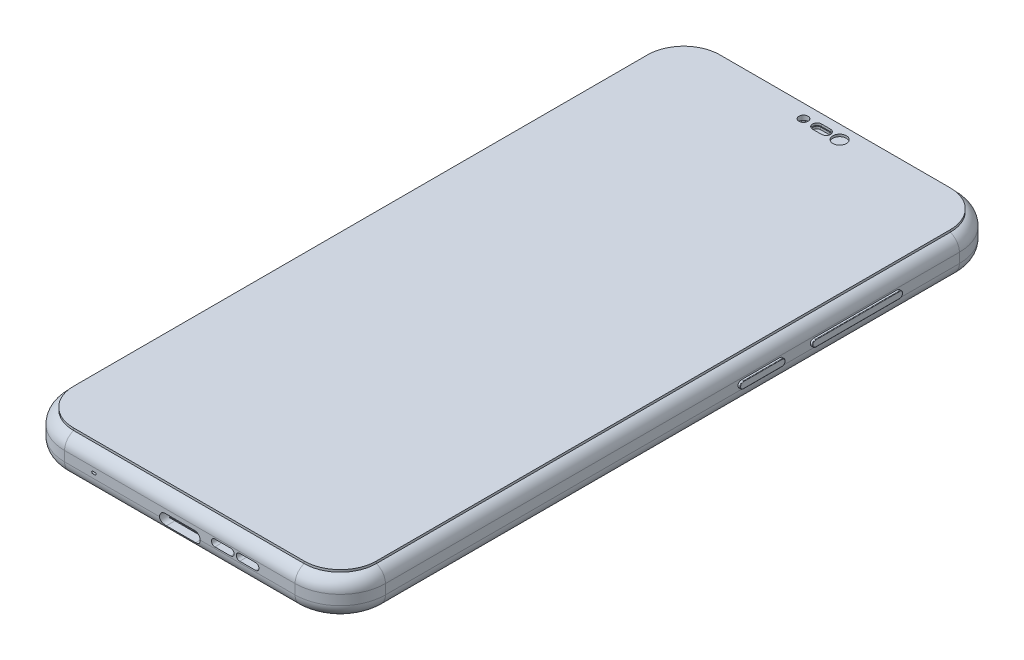
from build123d import *

# Parameters (mm, degrees)
BOSS_EXTRUDE1_DEPTH      = 8
BOSS_EXTRUDE2_DEPTH      = 0.5
FILLET1_R                = 3
BOSS_EXTRUDE3_DEPTH      = 1
FILLET2_R                = 1
CUT_EXTRUDE1_DEPTH       = 1
SKETCH5_R                = 2
CUT_EXTRUDE2_DEPTH       = 0.5
SKETCH6_R                = 0.5
SKETCH6_R_2              = 1
BOSS_EXTRUDE4_DEPTH      = 0.5
FILLET3_R                = 0.5
SKETCH7_R                = 2.5
BOSS_EXTRUDE5_DEPTH      = 0.5
BOSS_EXTRUDE6_DEPTH      = 1
BOSS_EXTRUDE7_DEPTH      = 0.2
SKETCH10_R               = 5
CUT_EXTRUDE3_DEPTH       = 0.2
CHAMFER1_SIZE            = 0.2
SKETCH13_R               = 2
CUT_EXTRUDE4_DEPTH       = 10
SKETCH14_R               = 0.25
CUT_EXTRUDE5_DEPTH       = 1
CUT_EXTRUDE6_DEPTH       = 2
SKETCH17_W               = 6.5
SKETCH17_H               = 0.2
CUT_EXTRUDE7_DEPTH       = 4
SKETCH18_W               = 6.5
SKETCH18_H               = 0.1
CUT_EXTRUDE8_DEPTH       = 1
BOSS_EXTRUDE8_DEPTH      = 0.5
FILLET4_R                = 0.1
SKETCH20_R               = 1.5
CUT_EXTRUDE9_DEPTH       = 0.5
CUT_EXTRUDE10_DEPTH      = 0.5
CUT_EXTRUDE10_DEPTH_BACK = 0.5
SKETCH21_R               = 1
SKETCH22_R               = 0.5
BOSS_EXTRUDE9_DEPTH      = 0.5
FILLET5_R                = 0.5


# Some blends are built 0.0001 mm under size
with BuildPart() as part:
    # Sketch1 → Boss-Extrude1 (new body)
    with BuildSketch(Plane(origin=(0, 0, 0), x_dir=(1, 0, 0), z_dir=(0, 1, 0))):
        with BuildLine():
            Line((-25.5, 73.5), (25.5, 73.5))
            ThreePointArc((25.5, 73.5), (32.571067812, 70.571067812), (35.5, 63.5))
            Line((35.5, 63.5), (35.5, -63.5))
            ThreePointArc((35.5, -63.5), (32.571067812, -70.571067812), (25.5, -73.5))
            Line((25.5, -73.5), (-25.5, -73.5))
            ThreePointArc((-25.5, -73.5), (-32.571067812, -70.571067812), (-35.5, -63.5))
            Line((-35.5, -63.5), (-35.5, 63.5))
            ThreePointArc((-35.5, 63.5), (-32.571067812, 70.571067812), (-25.5, 73.5))
        make_face()
    extrude(amount=BOSS_EXTRUDE1_DEPTH)

    # Sketch2 → Boss-Extrude2 (add)
    with BuildSketch(Plane(origin=(0, 8, 0), x_dir=(1, 0, 0), z_dir=(0, 1, 0))):
        with BuildLine():
            Line((-25.5, -71.5), (25.5, -71.5))
            ThreePointArc((25.5, -71.5), (31.156854249, -69.156854249), (33.5, -63.5))
            Line((33.5, -63.5), (33.5, 63.5))
            ThreePointArc((33.5, 63.5), (31.156854249, 69.156854249), (25.5, 71.5))
            Line((25.5, 71.5), (-25.5, 71.5))
            ThreePointArc((-25.5, 71.5), (-31.156854249, 69.156854249), (-33.5, 63.5))
            Line((-33.5, 63.5), (-33.5, -63.5))
            ThreePointArc((-33.5, -63.5), (-31.156854249, -69.156854249), (-25.5, -71.5))
        make_face()
    extrude(amount=BOSS_EXTRUDE2_DEPTH)

    # Fillet1
    # the kernel refuses this fillet: 3 mm, written as the material it takes off along each edge
    with BuildSketch(Plane(origin=(25.5, 8, 63.5), x_dir=(1, 0, 0), z_dir=(0, 0, -1))) as fillet1_piece_1:
        with BuildLine():
            CenterArc((7, 2.828427125), FILLET1_R, 289.471220634, 70.528779366)
            Line((10, 2.828427125), (10.06, 2.828427125))
            Line((10.06, 2.828427125), (10.06, 0))
            Line((10.06, 0), (10, -0.06))
            ThreePointArc((10, -0.06), (9, -0.06), (8.02, -0.056568542))
            Line((8.02, -0.056568542), (8, 0))
        make_face()
    revolve(axis=Axis((25.5, 8, 63.5), (0, -1, 0)), revolution_arc=90, mode=Mode.SUBTRACT)
    with BuildSketch(Plane(origin=(25.5, 0, 73.5), x_dir=(0, 0, -1), z_dir=(-1, 0, 0))) as fillet1_piece_2:
        with BuildLine():
            CenterArc((FILLET1_R, -FILLET1_R), FILLET1_R, 90, 90)
            Line((0, -FILLET1_R), (-FILLET1_R * 0.02, -FILLET1_R))
            Line((-FILLET1_R * 0.02, -FILLET1_R), (-FILLET1_R * 0.02, FILLET1_R * 0.02))
            Line((-FILLET1_R * 0.02, FILLET1_R * 0.02), (FILLET1_R, FILLET1_R * 0.02))
            Line((FILLET1_R, FILLET1_R * 0.02), (FILLET1_R, 0))
        make_face()
    extrude(amount=51, mode=Mode.SUBTRACT)
    with BuildSketch(Plane(origin=(-25.5, 0, 63.5), x_dir=(0, 0, 1), z_dir=(1, 0, 0))) as fillet1_piece_3:
        with BuildLine():
            CenterArc((10 - FILLET1_R, -FILLET1_R), FILLET1_R, 0, 90)
            Line((10, -FILLET1_R), (10 + FILLET1_R * 0.02, -FILLET1_R))
            Line((10 + FILLET1_R * 0.02, -FILLET1_R), (10 + FILLET1_R * 0.02, FILLET1_R * 0.02))
            Line((10 + FILLET1_R * 0.02, FILLET1_R * 0.02), (10 - FILLET1_R, FILLET1_R * 0.02))
            Line((10 - FILLET1_R, FILLET1_R * 0.02), (10 - FILLET1_R, 0))
        make_face()
    revolve(axis=Axis((-25.5, 0, 63.5), (0, -1, 0)), revolution_arc=90, mode=Mode.SUBTRACT)
    with BuildSketch(Plane(origin=(35.5, 8, -63.5), x_dir=(-1, 0, 0), z_dir=(0, 0, 1))) as fillet1_piece_4:
        with BuildLine():
            CenterArc((3, 2.828427125), FILLET1_R, 180, 70.528779366)
            Line((0, 2.828427125), (-0.06, 2.828427125))
            Line((-0.06, 2.828427125), (-0.06, 0))
            Line((-0.06, 0), (0, -0.06))
            ThreePointArc((0, -0.06), (1, -0.06), (1.98, -0.056568542))
            Line((1.98, -0.056568542), (2, 0))
        make_face()
    extrude(amount=127, mode=Mode.SUBTRACT)
    with BuildSketch(Plane(origin=(25.5, 8, -63.5), x_dir=(0, 0, -1), z_dir=(-1, 0, 0))) as fillet1_piece_5:
        with BuildLine():
            CenterArc((7, 2.828427125), FILLET1_R, 289.471220634, 70.528779366)
            Line((10, 2.828427125), (10.06, 2.828427125))
            Line((10.06, 2.828427125), (10.06, 0))
            Line((10.06, 0), (10, -0.06))
            ThreePointArc((10, -0.06), (9, -0.06), (8.02, -0.056568542))
            Line((8.02, -0.056568542), (8, 0))
        make_face()
    revolve(axis=Axis((25.5, 8, -63.5), (0, -1, 0)), revolution_arc=90, mode=Mode.SUBTRACT)
    with BuildSketch(Plane(origin=(-25.5, 8, -73.5), x_dir=(0, -1, 0), z_dir=(1, 0, 0))) as fillet1_piece_6:
        with BuildLine():
            CenterArc((2.828427125, -3), FILLET1_R, 90, 70.528779366)
            Line((0, -2), (-0.056568542, -1.98))
            ThreePointArc((-0.056568542, -1.98), (-0.06, -1), (-0.06, 0))
            Line((-0.06, 0), (0, 0.06))
            Line((0, 0.06), (2.828427125, 0.06))
            Line((2.828427125, 0.06), (2.828427125, 0))
        make_face()
    extrude(amount=51, mode=Mode.SUBTRACT)
    with BuildSketch(Plane(origin=(-25.5, 8, -63.5), x_dir=(-1, 0, 0), z_dir=(0, 0, 1))) as fillet1_piece_7:
        with BuildLine():
            CenterArc((7, 2.828427125), FILLET1_R, 289.471220634, 70.528779366)
            Line((8, 0), (8.02, -0.056568542))
            ThreePointArc((8.02, -0.056568542), (9, -0.06), (10, -0.06))
            Line((10, -0.06), (10.06, 0))
            Line((10.06, 0), (10.06, 2.828427125))
            Line((10.06, 2.828427125), (10, 2.828427125))
        make_face()
    revolve(axis=Axis((-25.5, 8, -63.5), (0, -1, 0)), revolution_arc=90, mode=Mode.SUBTRACT)
    with BuildSketch(Plane(origin=(-35.5, 8, 63.5), x_dir=(0, -1, 0), z_dir=(0, 0, -1))) as fillet1_piece_8:
        with BuildLine():
            CenterArc((2.828427125, -3), FILLET1_R, 90, 70.528779366)
            Line((0, -2), (-0.056568542, -1.98))
            ThreePointArc((-0.056568542, -1.98), (-0.06, -1), (-0.06, 0))
            Line((-0.06, 0), (0, 0.06))
            Line((0, 0.06), (2.828427125, 0.06))
            Line((2.828427125, 0.06), (2.828427125, 0))
        make_face()
    extrude(amount=127, mode=Mode.SUBTRACT)
    with BuildSketch(Plane(origin=(-25.5, 8, 63.5), x_dir=(0, 0, 1), z_dir=(1, 0, 0))) as fillet1_piece_9:
        with BuildLine():
            CenterArc((7, 2.828427125), FILLET1_R, 289.471220634, 70.528779366)
            Line((10, 2.828427125), (10.06, 2.828427125))
            Line((10.06, 2.828427125), (10.06, 0))
            Line((10.06, 0), (10, -0.06))
            ThreePointArc((10, -0.06), (9, -0.06), (8.02, -0.056568542))
            Line((8.02, -0.056568542), (8, 0))
        make_face()
    revolve(axis=Axis((-25.5, 8, 63.5), (0, -1, 0)), revolution_arc=90, mode=Mode.SUBTRACT)
    with BuildSketch(Plane(origin=(25.5, 8, 73.5), x_dir=(0, 0, -1), z_dir=(-1, 0, 0))) as fillet1_piece_10:
        with BuildLine():
            CenterArc((3, 2.828427125), FILLET1_R, 180, 70.528779366)
            Line((0, 2.828427125), (-0.06, 2.828427125))
            Line((-0.06, 2.828427125), (-0.06, 0))
            Line((-0.06, 0), (0, -0.06))
            ThreePointArc((0, -0.06), (1, -0.06), (1.98, -0.056568542))
            Line((1.98, -0.056568542), (2, 0))
        make_face()
    extrude(amount=51, mode=Mode.SUBTRACT)
    with BuildSketch(Plane(origin=(-35.5, 0, 63.5), x_dir=(0, 1, 0), z_dir=(0, 0, -1))) as fillet1_piece_11:
        with BuildLine():
            CenterArc((FILLET1_R, FILLET1_R), FILLET1_R, 180, 90)
            Line((0, FILLET1_R), (-FILLET1_R * 0.02, FILLET1_R))
            Line((-FILLET1_R * 0.02, FILLET1_R), (-FILLET1_R * 0.02, -FILLET1_R * 0.02))
            Line((-FILLET1_R * 0.02, -FILLET1_R * 0.02), (FILLET1_R, -FILLET1_R * 0.02))
            Line((FILLET1_R, -FILLET1_R * 0.02), (FILLET1_R, 0))
        make_face()
    extrude(amount=127, mode=Mode.SUBTRACT)
    with BuildSketch(Plane(origin=(-25.5, 0, -63.5), x_dir=(-1, 0, 0), z_dir=(0, 0, 1))) as fillet1_piece_12:
        with BuildLine():
            CenterArc((10 - FILLET1_R, -FILLET1_R), FILLET1_R, 0, 90)
            Line((10 - FILLET1_R, 0), (10 - FILLET1_R, FILLET1_R * 0.02))
            Line((10 - FILLET1_R, FILLET1_R * 0.02), (10 + FILLET1_R * 0.02, FILLET1_R * 0.02))
            Line((10 + FILLET1_R * 0.02, FILLET1_R * 0.02), (10 + FILLET1_R * 0.02, -FILLET1_R))
            Line((10 + FILLET1_R * 0.02, -FILLET1_R), (10, -FILLET1_R))
        make_face()
    revolve(axis=Axis((-25.5, 0, -63.5), (0, -1, 0)), revolution_arc=90, mode=Mode.SUBTRACT)
    with BuildSketch(Plane(origin=(-25.5, 0, -73.5), x_dir=(0, 1, 0), z_dir=(1, 0, 0))) as fillet1_piece_13:
        with BuildLine():
            CenterArc((FILLET1_R, FILLET1_R), FILLET1_R, 180, 90)
            Line((0, FILLET1_R), (-FILLET1_R * 0.02, FILLET1_R))
            Line((-FILLET1_R * 0.02, FILLET1_R), (-FILLET1_R * 0.02, -FILLET1_R * 0.02))
            Line((-FILLET1_R * 0.02, -FILLET1_R * 0.02), (FILLET1_R, -FILLET1_R * 0.02))
            Line((FILLET1_R, -FILLET1_R * 0.02), (FILLET1_R, 0))
        make_face()
    extrude(amount=51, mode=Mode.SUBTRACT)
    with BuildSketch(Plane(origin=(25.5, 0, -63.5), x_dir=(0, 0, -1), z_dir=(-1, 0, 0))) as fillet1_piece_14:
        with BuildLine():
            CenterArc((10 - FILLET1_R, -FILLET1_R), FILLET1_R, 0, 90)
            Line((10, -FILLET1_R), (10 + FILLET1_R * 0.02, -FILLET1_R))
            Line((10 + FILLET1_R * 0.02, -FILLET1_R), (10 + FILLET1_R * 0.02, FILLET1_R * 0.02))
            Line((10 + FILLET1_R * 0.02, FILLET1_R * 0.02), (10 - FILLET1_R, FILLET1_R * 0.02))
            Line((10 - FILLET1_R, FILLET1_R * 0.02), (10 - FILLET1_R, 0))
        make_face()
    revolve(axis=Axis((25.5, 0, -63.5), (0, -1, 0)), revolution_arc=90, mode=Mode.SUBTRACT)
    with BuildSketch(Plane(origin=(35.5, 0, -63.5), x_dir=(-1, 0, 0), z_dir=(0, 0, 1))) as fillet1_piece_15:
        with BuildLine():
            CenterArc((FILLET1_R, -FILLET1_R), FILLET1_R, 90, 90)
            Line((0, -FILLET1_R), (-FILLET1_R * 0.02, -FILLET1_R))
            Line((-FILLET1_R * 0.02, -FILLET1_R), (-FILLET1_R * 0.02, FILLET1_R * 0.02))
            Line((-FILLET1_R * 0.02, FILLET1_R * 0.02), (FILLET1_R, FILLET1_R * 0.02))
            Line((FILLET1_R, FILLET1_R * 0.02), (FILLET1_R, 0))
        make_face()
    extrude(amount=127, mode=Mode.SUBTRACT)
    with BuildSketch(Plane(origin=(25.5, 0, 63.5), x_dir=(1, 0, 0), z_dir=(0, 0, -1))) as fillet1_piece_16:
        with BuildLine():
            CenterArc((10 - FILLET1_R, -FILLET1_R), FILLET1_R, 0, 90)
            Line((10, -FILLET1_R), (10 + FILLET1_R * 0.02, -FILLET1_R))
            Line((10 + FILLET1_R * 0.02, -FILLET1_R), (10 + FILLET1_R * 0.02, FILLET1_R * 0.02))
            Line((10 + FILLET1_R * 0.02, FILLET1_R * 0.02), (10 - FILLET1_R, FILLET1_R * 0.02))
            Line((10 - FILLET1_R, FILLET1_R * 0.02), (10 - FILLET1_R, 0))
        make_face()
    revolve(axis=Axis((25.5, 0, 63.5), (0, -1, 0)), revolution_arc=90, mode=Mode.SUBTRACT)

    # Sketch3 → Boss-Extrude3 (add)
    with BuildSketch(Plane.XZ):
        with BuildLine():
            Line((-6, -58.5), (-6, -40.5))
            ThreePointArc((-6, -40.5), (0, -34.5), (6, -40.5))
            Line((6, -40.5), (6, -58.5))
            ThreePointArc((6, -58.5), (0, -64.5), (-6, -58.5))
        make_face()
    extrude(amount=BOSS_EXTRUDE3_DEPTH)

    # Fillet2
    fillet2_edges = [part.edges().sort_by_distance(p)[0] for p in [
        (-6, -1, -49.5),
        (0, -1, -34.5),
        (6, -1, -49.5),
        (0, -1, -64.5),
    ]]
    fillet(fillet2_edges, radius=FILLET2_R - 0.0001)  # a hair under: the kernel refuses the full size

    # Sketch4 → Cut-Extrude1 (cut)
    with BuildSketch(Plane.XZ.offset(1)):
        with BuildLine():
            Line((-5, -40.5), (-5, -58.5))
            ThreePointArc((-5, -58.5), (0, -63.5), (5, -58.5))
            Line((5, -58.5), (5, -40.5))
            ThreePointArc((5, -40.5), (0, -35.5), (-5, -40.5))
        make_face()
    extrude(amount=-CUT_EXTRUDE1_DEPTH, mode=Mode.SUBTRACT)

    # Sketch5 → Cut-Extrude2 (cut)
    with BuildSketch(Plane.XZ):
        with Locations(Location((0, -58.5, 0), (0, 0, 270))):
            Circle(SKETCH5_R)
        with Locations(Location((0, -49.5, 0), (0, 0, 270))):
            Circle(SKETCH5_R)
    extrude(amount=-CUT_EXTRUDE2_DEPTH, mode=Mode.SUBTRACT)

    # Sketch6 → Boss-Extrude4 (add)
    with BuildSketch(Plane.XZ.offset(-0.5)):
        with Locations(Location((0, -58.5, 0), (0, 0, 270))):
            Circle(SKETCH6_R)
        with Locations(Location((0, -49.5, 0), (0, 0, 270))):
            Circle(SKETCH6_R_2)
    extrude(amount=BOSS_EXTRUDE4_DEPTH)

    # Fillet3
    fillet3_edges = [part.edges().sort_by_distance(p)[0] for p in [
        (0, 0, -58),
        (0, 0, -48.5),
    ]]
    fillet(fillet3_edges, radius=FILLET3_R - 0.0001)  # a hair under: the kernel refuses the full size

    # Sketch7 → Boss-Extrude5 (add)
    with BuildSketch(Plane.XZ):
        with Locations(Location((0, -40.5, 0), (0, 0, 270))):
            Circle(SKETCH7_R)
    extrude(amount=BOSS_EXTRUDE5_DEPTH)

    # Sketch8 → Boss-Extrude6 (add)
    with BuildSketch(Plane(origin=(0, -1, 0), x_dir=(-1, 0, 0), z_dir=(0, -1, 0))):
        with BuildLine():
            Line((5, 40.5), (5, 58.5))
            ThreePointArc((5, 58.5), (0, 63.5), (-5, 58.5))
            Line((-5, 58.5), (-5, 40.5))
            ThreePointArc((-5, 40.5), (0, 35.5), (5, 40.5))
        make_face()
        with BuildLine():
            Line((4.8, 40.5), (4.8, 58.5))
            ThreePointArc((4.8, 58.5), (0, 63.3), (-4.8, 58.5))
            Line((-4.8, 58.5), (-4.8, 40.5))
            ThreePointArc((-4.8, 40.5), (0, 35.7), (4.8, 40.5))
        make_face(mode=Mode.SUBTRACT)
    extrude(amount=-BOSS_EXTRUDE6_DEPTH)

    # Sketch10 → Cut-Extrude3 (cut)
    with BuildSketch(Plane.XZ):
        with Locations(Location((0, -25.5, 0), (0, 0, 270))):
            Circle(SKETCH10_R)
    extrude(amount=-CUT_EXTRUDE3_DEPTH, mode=Mode.SUBTRACT)

    # Chamfer1
    chamfer1_edges = [part.edges().sort_by_distance(p)[0] for p in [
        (0, 0.2, -20.5),
    ]]
    chamfer(chamfer1_edges, length=CHAMFER1_SIZE - 0.0001)  # a hair under: the kernel refuses the full size

    # Sketch13 → Cut-Extrude4 (cut)
    with BuildSketch(Plane(origin=(0, 0, -73.5), x_dir=(-1, 0, 0), z_dir=(0, 0, -1))):
        with Locations((-21.5, 3)):
            Circle(SKETCH13_R)
    extrude(amount=-CUT_EXTRUDE4_DEPTH, mode=Mode.SUBTRACT)

    # Sketch14 → Cut-Extrude5 (cut)
    # profile 1 of 2: a face of its own
    with BuildSketch(Plane.ZY.offset(35.5)):
        with BuildLine():
            Line((-41.5, 5.085786438), (-25.5, 5.085786438))
            ThreePointArc((-25.5, 5.085786438), (-24.5, 4.085786438), (-25.5, 3.085786438))
            Line((-25.5, 3.085786438), (-41.5, 3.085786438))
            ThreePointArc((-41.5, 3.085786438), (-42.5, 4.085786438), (-41.5, 5.085786438))
        make_face()
        with BuildLine():
            Line((-41.5, 4.985786438), (-25.5, 4.985786438))
            ThreePointArc((-25.5, 4.985786438), (-24.6, 4.085786438), (-25.5, 3.185786438))
            Line((-25.5, 3.185786438), (-41.5, 3.185786438))
            ThreePointArc((-41.5, 3.185786438), (-42.4, 4.085786438), (-41.5, 4.985786438))
        make_face(mode=Mode.SUBTRACT)
    # profile 2 of 2: a face of its own
    with BuildSketch(Plane.ZY.offset(35.5)):
        with Locations((-25.5, 4.085786438)):
            Circle(SKETCH14_R)
    extrude(amount=-CUT_EXTRUDE5_DEPTH, mode=Mode.SUBTRACT)

    # Sketch15 → Cut-Extrude6 (cut)
    with BuildSketch(Plane.XY.offset(73.5)):
        with BuildLine():
            Line((7.75, 4.835786438), (11.25, 4.835786438))
            ThreePointArc((11.25, 4.835786438), (12, 4.085786438), (11.25, 3.335786438))
            Line((11.25, 3.335786438), (7.75, 3.335786438))
            ThreePointArc((7.75, 3.335786438), (7, 4.085786438), (7.75, 4.835786438))
        make_face()
        with BuildLine():
            Line((13.25, 4.835786438), (16.75, 4.835786438))
            ThreePointArc((16.75, 4.835786438), (17.5, 4.085786438), (16.75, 3.335786438))
            Line((16.75, 3.335786438), (13.25, 3.335786438))
            ThreePointArc((13.25, 3.335786438), (12.5, 4.085786438), (13.25, 4.835786438))
        make_face()
        with BuildLine():
            Line((-19.25, 4.335786438), (-18.75, 4.335786438))
            ThreePointArc((-18.75, 4.335786438), (-18.5, 4.085786438), (-18.75, 3.835786438))
            Line((-18.75, 3.835786438), (-19.25, 3.835786438))
            ThreePointArc((-19.25, 3.835786438), (-19.5, 4.085786438), (-19.25, 4.335786438))
        make_face()
    extrude(amount=-CUT_EXTRUDE6_DEPTH, mode=Mode.SUBTRACT)

    # Sketch17 → Cut-Extrude7 (cut)
    with BuildSketch(Plane.XY.offset(73.5)):
        with BuildLine():
            Line((-3.25, 4.25), (3.25, 4.25))
            ThreePointArc((3.25, 4.25), (4.5, 3), (3.25, 1.75))
            Line((3.25, 1.75), (-3.25, 1.75))
            ThreePointArc((-3.25, 1.75), (-4.5, 3), (-3.25, 4.25))
        make_face()
        with Locations((0, 3)):
            Rectangle(SKETCH17_W, SKETCH17_H, mode=Mode.SUBTRACT)
    extrude(amount=-CUT_EXTRUDE7_DEPTH, mode=Mode.SUBTRACT)

    # Sketch18 → Cut-Extrude8 (cut)
    with BuildSketch(Plane.XY.offset(73.5)):
        with Locations((0, 3.05)):
            Rectangle(SKETCH18_W, SKETCH18_H)
        with Locations((0, 2.95)):
            Rectangle(SKETCH18_W, SKETCH18_H)
    extrude(amount=-CUT_EXTRUDE8_DEPTH, mode=Mode.SUBTRACT)

    # Sketch19 → Boss-Extrude8 (add)
    with BuildSketch(Plane(origin=(35.5, 0, 0), x_dir=(0, 0, -1), z_dir=(1, 0, 0))):
        with BuildLine():
            Line((31.25, 4.835786438), (49.75, 4.835786438))
            ThreePointArc((49.75, 4.835786438), (50.5, 4.085786438), (49.75, 3.335786438))
            Line((49.75, 3.335786438), (31.25, 3.335786438))
            ThreePointArc((31.25, 3.335786438), (30.5, 4.085786438), (31.25, 4.835786438))
        make_face()
        with BuildLine():
            Line((15.25, 4.835786438), (23.75, 4.835786438))
            ThreePointArc((23.75, 4.835786438), (24.5, 4.085786438), (23.75, 3.335786438))
            Line((23.75, 3.335786438), (15.25, 3.335786438))
            ThreePointArc((15.25, 3.335786438), (14.5, 4.085786438), (15.25, 4.835786438))
        make_face()
    extrude(amount=BOSS_EXTRUDE8_DEPTH)

    # Fillet4
    fillet4_edges = [part.edges().sort_by_distance(p)[0] for p in [
        (36, 4.085786438, -30.5),
        (36, 3.335786438, -40.5),
        (36, 4.085786438, -50.5),
        (36, 4.835786438, -40.5),
        (36, 4.085786438, -14.5),
        (36, 3.335786438, -19.5),
        (36, 4.085786438, -24.5),
        (36, 4.835786438, -19.5),
    ]]
    fillet(fillet4_edges, radius=FILLET4_R)

    # Sketch20 → Cut-Extrude9 (cut)
    with BuildSketch(Plane(origin=(33.5, 8, 63.5), x_dir=(1, 0, 0), z_dir=(0, -1, 0))):
        with BuildLine():
            Line((-34.5, -133), (-32.5, -133))
            ThreePointArc((-32.5, -133), (-31.5, -132), (-32.5, -131))
            Line((-32.5, -131), (-34.5, -131))
            ThreePointArc((-34.5, -131), (-35.5, -132), (-34.5, -133))
        make_face()
        with Locations(Location((-29.5, -132, 0), (0, 0, 270))):
            Circle(SKETCH20_R)
    extrude(amount=-CUT_EXTRUDE9_DEPTH, mode=Mode.SUBTRACT)

    # Sketch21 → Cut-Extrude10 (cut, two sides: drawn at the far end of the back side and taken through both)
    with BuildSketch(Plane(origin=(0, 8, 0), x_dir=(1, 0, 0), z_dir=(0, 1, 0)).offset(-CUT_EXTRUDE10_DEPTH_BACK)):
        with BuildLine():
            Line((-1, 67.7), (1, 67.7))
            ThreePointArc((1, 67.7), (1.8, 68.5), (1, 69.3))
            Line((1, 69.3), (-1, 69.3))
            ThreePointArc((-1, 69.3), (-1.8, 68.5), (-1, 67.7))
        make_face()
        with Locations(Location((-4, 68.5, 0), (0, 0, 270))):
            Circle(SKETCH21_R)
    extrude(amount=CUT_EXTRUDE10_DEPTH + CUT_EXTRUDE10_DEPTH_BACK, mode=Mode.SUBTRACT)

    # Sketch22 → Boss-Extrude9 (add)
    with BuildSketch(Plane(origin=(0, 7.5, 0), x_dir=(1, 0, 0), z_dir=(0, 1, 0))):
        with Locations(Location((-4, 68.5, 0), (0, 0, 270))):
            Circle(SKETCH22_R)
    extrude(amount=BOSS_EXTRUDE9_DEPTH)

    # Fillet5
    fillet5_edges = [part.edges().sort_by_distance(p)[0] for p in [
        (-4, 8, -69),
    ]]
    fillet(fillet5_edges, radius=FILLET5_R - 0.0001)  # a hair under: the kernel refuses the full size


with BuildPart() as body_2:
    # Sketch9 → Boss-Extrude7 (new body)
    with BuildSketch(Plane(origin=(0, -1, 0), x_dir=(-1, 0, 0), z_dir=(0, -1, 0))):
        with BuildLine():
            Line((-4.7, 58.5), (-4.7, 40.5))
            ThreePointArc((-4.7, 40.5), (0, 35.8), (4.7, 40.5))
            Line((4.7, 40.5), (4.7, 58.5))
            ThreePointArc((4.7, 58.5), (0, 63.2), (-4.7, 58.5))
        make_face()
    extrude(amount=-BOSS_EXTRUDE7_DEPTH)


solid = Compound([part.part, body_2.part])
